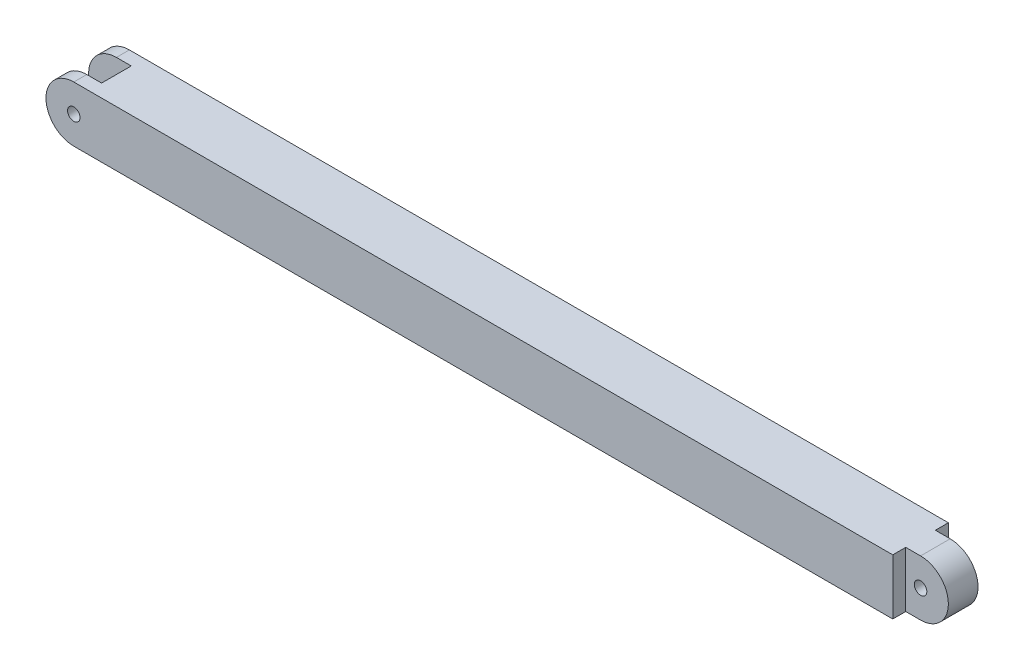
from build123d import *

# Parameters (mm, degrees)
BOSS_EXTRUDE1_DEPTH      = 15
H_0_266_DIAMETER_HOLE1_D = 6.7564
SKETCH5_W                = 40
SKETCH5_H                = 16
SKETCH5_H_2              = 20.916111238
CUT_EXTRUDE1_DEPTH       = 243.332416321


with BuildPart() as part:
    # Sketch1 → Boss-Extrude1 (new, symmetric)
    with BuildSketch(Plane.XY):
        with BuildLine():
            Line((-225, 15), (225, 15))
            ThreePointArc((225, 15), (240, 0), (225, -15))
            Line((225, -15), (-225, -15))
            ThreePointArc((-225, -15), (-240, 0), (-225, 15))
        make_face()
    extrude(amount=BOSS_EXTRUDE1_DEPTH, both=True)

    # H (0.266) Diameter Hole1 (through all)
    with Locations(Plane.XY.offset(15)):
        with Locations((-225, 0), (225, 0)):
            Hole(H_0_266_DIAMETER_HOLE1_D / 2)

    # Sketch5 → Cut-Extrude1 (cut, through all)
    with BuildSketch(Plane(origin=(0, 15, 0), x_dir=(1, 0, 0), z_dir=(0, 1, 0))):
        with Locations((-237, 0)):
            Rectangle(SKETCH5_W, SKETCH5_H)
        with Locations((237, 18.458055619)):
            Rectangle(SKETCH5_W, SKETCH5_H_2)
        with Locations((237, -18.458055619)):
            Rectangle(SKETCH5_W, SKETCH5_H_2)
    extrude(amount=-CUT_EXTRUDE1_DEPTH, mode=Mode.SUBTRACT)


solid = part.part
